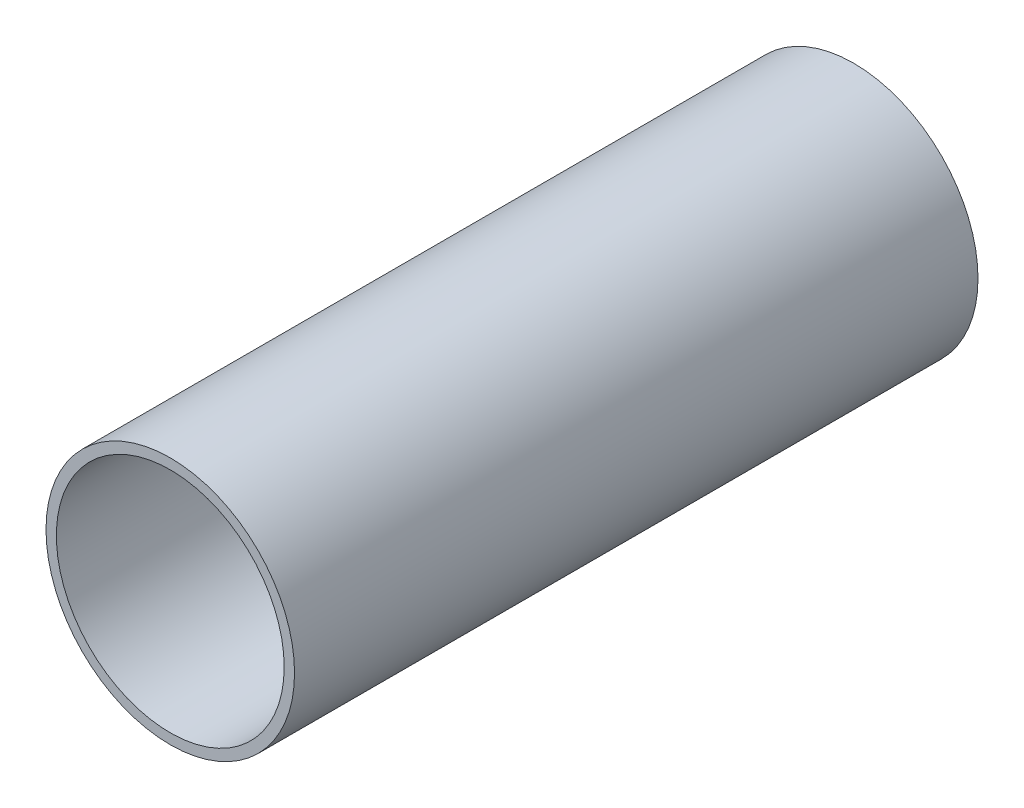
from build123d import *

# Parameters (mm, degrees)
SKETCH1_R           = 76.2
SKETCH1_R_2         = 69.85
BOSS_EXTRUDE1_DEPTH = 406.4
BOSS_EXTRUDE2_START = -12.7
SKETCH1_3_R         = 76.2
SKETCH1_3_R_2       = 63.5
BOSS_EXTRUDE2_DEPTH = 12.7


with BuildPart() as part:
    # Sketch1 → Boss-Extrude1 (new body)
    with BuildSketch(Plane.XY):
        Circle(SKETCH1_R)
        Circle(SKETCH1_R_2, mode=Mode.SUBTRACT)
    extrude(amount=BOSS_EXTRUDE1_DEPTH)

    # Sketch1<3> → Boss-Extrude2 (add)
    with BuildSketch(Plane.XY.offset(BOSS_EXTRUDE2_START)):
        Circle(SKETCH1_3_R)
        Circle(SKETCH1_3_R_2, mode=Mode.SUBTRACT)
    extrude(amount=BOSS_EXTRUDE2_DEPTH)


solid = part.part
